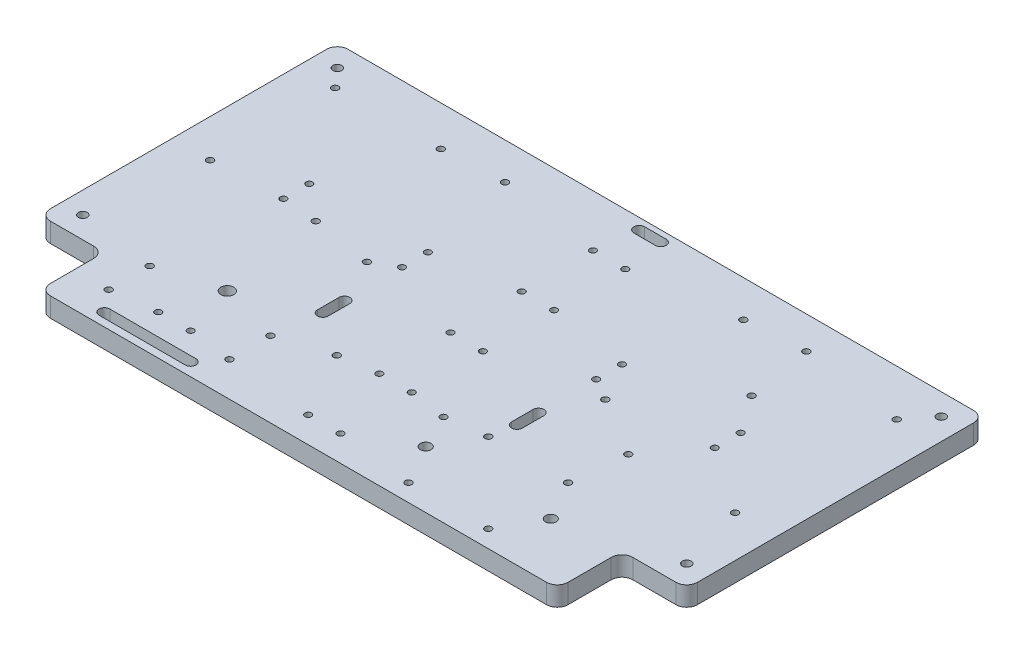
from build123d import *

# Parameters (mm, degrees)
ESQUISSE1_R             = 2.05
ESQUISSE1_R_2           = 1.55
ESQUISSE1_R_3           = 2.5
ESQUISSE1_R_4           = 3
BOSS_EXTRU_1_DEPTH      = 9
CONG_2_R                = 5
ESQUISSE2_R             = 1.5
ENL_V_MAT_EXTRU_1_DEPTH = 10


with BuildPart() as part:
    # Esquisse1 → Boss.-Extru.1 (new body)
    with BuildSketch(Plane(origin=(0, 0, 0), x_dir=(1, 0, 0), z_dir=(0, 1, 0))):
        Polygon((150, -69), (150, 69), (-149.848840409, 69), (-150, 69), (-150, -69), (-120, -69), (-120, -99), (120, -99), (120, -69), align=None)
        with Locations((-140, 59)):
            Circle(ESQUISSE1_R, mode=Mode.SUBTRACT)
        with Locations((140, 59)):
            Circle(ESQUISSE1_R, mode=Mode.SUBTRACT)
        with Locations((140, -59)):
            Circle(ESQUISSE1_R, mode=Mode.SUBTRACT)
        with Locations((-140, -59)):
            Circle(ESQUISSE1_R, mode=Mode.SUBTRACT)
        with Locations((-48, -83)):
            Circle(ESQUISSE1_R_2, mode=Mode.SUBTRACT)
        with Locations((-104, -83)):
            Circle(ESQUISSE1_R_2, mode=Mode.SUBTRACT)
        with Locations((-48, -64)):
            Circle(ESQUISSE1_R_2, mode=Mode.SUBTRACT)
        with Locations((-104, -64)):
            Circle(ESQUISSE1_R_2, mode=Mode.SUBTRACT)
        with Locations((82.54, -28.63)):
            Circle(ESQUISSE1_R_2, mode=Mode.SUBTRACT)
        with Locations((130.8, -27.36)):
            Circle(ESQUISSE1_R_2, mode=Mode.SUBTRACT)
        with Locations((130.8, 47.57)):
            Circle(ESQUISSE1_R_2, mode=Mode.SUBTRACT)
        with Locations((82.54, 53.92)):
            Circle(ESQUISSE1_R_2, mode=Mode.SUBTRACT)
        with Locations((87.62, 23.44)):
            Circle(ESQUISSE1_R_2, mode=Mode.SUBTRACT)
        with Locations((43, -54)):
            Circle(ESQUISSE1_R_2, mode=Mode.SUBTRACT)
        with Locations((80, -54)):
            Circle(ESQUISSE1_R_2, mode=Mode.SUBTRACT)
        with Locations((80, -91)):
            Circle(ESQUISSE1_R_2, mode=Mode.SUBTRACT)
        with Locations((43, -91)):
            Circle(ESQUISSE1_R_2, mode=Mode.SUBTRACT)
        with Locations((-132.5, 50.5)):
            Circle(ESQUISSE1_R_2, mode=Mode.SUBTRACT)
        with Locations((-132.5, -7.5)):
            Circle(ESQUISSE1_R_2, mode=Mode.SUBTRACT)
        with Locations((-83.5, -7.5)):
            Circle(ESQUISSE1_R_2, mode=Mode.SUBTRACT)
        with Locations((-83.5, 50.5)):
            Circle(ESQUISSE1_R_2, mode=Mode.SUBTRACT)
        with Locations((-55.25, 52)):
            Circle(ESQUISSE1_R_2, mode=Mode.SUBTRACT)
        with Locations((-55.25, -12)):
            Circle(ESQUISSE1_R_2, mode=Mode.SUBTRACT)
        with Locations((55.25, 52)):
            Circle(ESQUISSE1_R_2, mode=Mode.SUBTRACT)
        with Locations((55.25, -12)):
            Circle(ESQUISSE1_R_2, mode=Mode.SUBTRACT)
        with Locations((-24.75, -56.5)):
            Circle(ESQUISSE1_R_2, mode=Mode.SUBTRACT)
        with Locations((24.75, -56.5)):
            Circle(ESQUISSE1_R_2, mode=Mode.SUBTRACT)
        with Locations((32.5, -72.5)):
            Circle(ESQUISSE1_R_3, mode=Mode.SUBTRACT)
        with Locations((90.5, -72.5)):
            Circle(ESQUISSE1_R_3, mode=Mode.SUBTRACT)
        with Locations((-76, -56)):
            Circle(ESQUISSE1_R_4, mode=Mode.SUBTRACT)
        with BuildLine():
            Line((-56, -95.5), (-96, -95.5))
            ThreePointArc((-96, -95.5), (-98.5, -93), (-96, -90.5))
            Line((-96, -90.5), (-56, -90.5))
            ThreePointArc((-56, -90.5), (-53.5, -93), (-56, -95.5))
        make_face(mode=Mode.SUBTRACT)
        with BuildLine():
            Line((-5, 66.5), (5, 66.5))
            ThreePointArc((5, 66.5), (7.5, 64), (5, 61.5))
            Line((5, 61.5), (-5, 61.5))
            ThreePointArc((-5, 61.5), (-7.5, 64), (-5, 66.5))
        make_face(mode=Mode.SUBTRACT)
        with BuildLine():
            Line((-42.5, -32.709135822), (-42.5, -42.709135822))
            ThreePointArc((-42.5, -42.709135822), (-45, -45.209135822), (-47.5, -42.709135822))
            Line((-47.5, -42.709135822), (-47.5, -32.709135822))
            ThreePointArc((-47.5, -32.709135822), (-45, -30.209135822), (-42.5, -32.709135822))
        make_face(mode=Mode.SUBTRACT)
        with BuildLine():
            Line((42.5, -32.709135822), (42.5, -42.709135822))
            ThreePointArc((42.5, -42.709135822), (45, -45.209135822), (47.5, -42.709135822))
            Line((47.5, -42.709135822), (47.5, -32.709135822))
            ThreePointArc((47.5, -32.709135822), (45, -30.209135822), (42.5, -32.709135822))
        make_face(mode=Mode.SUBTRACT)
    extrude(amount=BOSS_EXTRU_1_DEPTH)

    # Congé2
    cong_2_edges = [part.edges().sort_by_distance(p)[0] for p in [
        (150, 4.5, -69),
        (-150, 4.5, -69),
        (-150, 4.5, 69),
        (150, 4.5, 69),
        (120, 4.5, 69),
        (120, 4.5, 99),
        (-120, 4.5, 69),
        (-120, 4.5, 99),
    ]]
    fillet(cong_2_edges, radius=CONG_2_R)

    # Esquisse2 → Enlèv. mat.-Extru.1 (cut)
    with BuildSketch(Plane(origin=(0, 9, 0), x_dir=(1, 0, 0), z_dir=(0, 1, 0))):
        with Locations((-7.5, 45)):
            Circle(ESQUISSE2_R)
        with Locations((7.5, 45)):
            Circle(ESQUISSE2_R)
        with Locations((-7.5, 12)):
            Circle(ESQUISSE2_R)
        with Locations((7.5, 12)):
            Circle(ESQUISSE2_R)
        with Locations((-7.5, -21)):
            Circle(ESQUISSE2_R)
        with Locations((7.5, -21)):
            Circle(ESQUISSE2_R)
        with Locations((-7.5, -54)):
            Circle(ESQUISSE2_R)
        with Locations((7.5, -54)):
            Circle(ESQUISSE2_R)
        with Locations((-7.5, -87)):
            Circle(ESQUISSE2_R)
        with Locations((7.5, -87)):
            Circle(ESQUISSE2_R)
        with Locations((-100, 6)):
            Circle(ESQUISSE2_R)
        with Locations((-100, -6)):
            Circle(ESQUISSE2_R)
        with Locations((100, -6)):
            Circle(ESQUISSE2_R)
        with Locations((100, 6)):
            Circle(ESQUISSE2_R)
        with Locations((-83.5, -80.5)):
            Circle(ESQUISSE2_R)
        with Locations((-68.5, -80.5)):
            Circle(ESQUISSE2_R)
        with Locations((-45, -6)):
            Circle(ESQUISSE2_R)
        with Locations((-45, 6)):
            Circle(ESQUISSE2_R)
        with Locations((45, 6)):
            Circle(ESQUISSE2_R)
        with Locations((45, -6)):
            Circle(ESQUISSE2_R)
    extrude(amount=-ENL_V_MAT_EXTRU_1_DEPTH, mode=Mode.SUBTRACT)


solid = part.part
